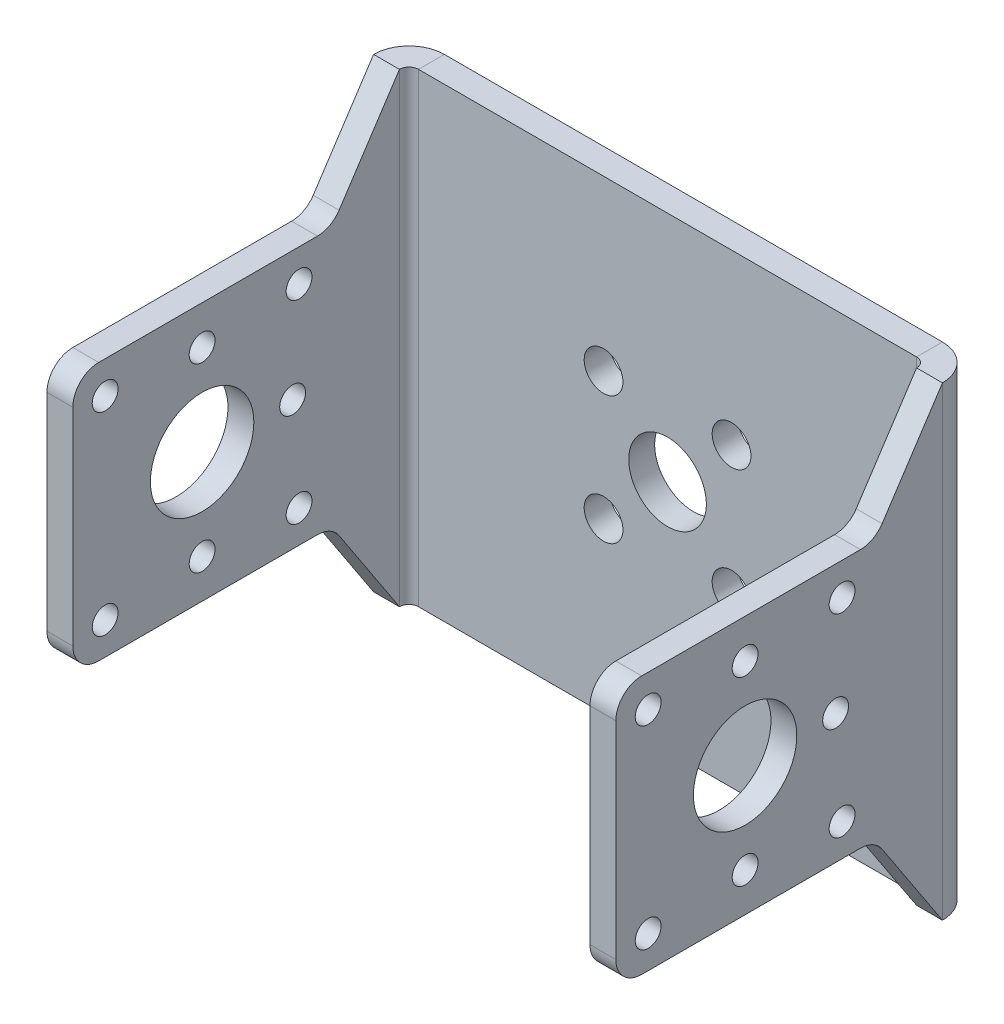
from build123d import *

# Parameters (mm, degrees)
SKETCH_1_W                       = 44
SKETCH_1_H                       = 36
SM_BASE_FLANGE_1_DEPTH           = 2
SM_EDGE_FLANGE_3_STRIP_W         = 9.4732
SM_EDGE_FLANGE_3_STRIP_H         = 2
SM_EDGE_FLANGE_3_STRIP_CUT_DEPTH = 36
SM_EDGE_FLANGE_3_DEPTH           = 36
SM_EDGE_FLANGE_4_STRIP_W         = 9.4732
SM_EDGE_FLANGE_4_STRIP_H         = 2
SM_EDGE_FLANGE_4_STRIP_CUT_DEPTH = 36
SM_EDGE_FLANGE_4_DEPTH           = 36
CUT_EXTRUDE_2_DEPTH              = 50
SKETCH_20_R                      = 1
CUT_EXTRUDE_3_DEPTH              = 50
FILLET_2_R                       = 2
FILLET_3_R                       = 2
FILLET_4_R                       = 2
FILLET_5_R                       = 2
FILLET_8_R                       = 2
FILLET_9_R                       = 2
FILLET_10_R                      = 2
FILLET_11_R                      = 2
SKETCH_21_R                      = 3
SKETCH_21_R_2                    = 1.5
CUT_EXTRUDE_4_DEPTH              = 2
SKETCH_22_R                      = 4
CUT_EXTRUDE_5_DEPTH              = 50


# Sheet-metal steps are written as plain solids
with BuildPart() as part:
    # Sketch 1 → 基体-法兰1 (new body)
    with BuildSketch(Plane.XY):
        with Locations((1.829071755, 6.237870574)):
            Rectangle(SKETCH_1_W, SKETCH_1_H)
    extrude(amount=-SM_BASE_FLANGE_1_DEPTH)

    # 边线-法兰3 strip (across the edge) → 边线-法兰3 strip cut (cut)
    with BuildSketch(Plane(origin=(-20.170928245, 24.237870574, 0), x_dir=(1, 0, 0), z_dir=(0, -1, 0))):
        with Locations((-2, -1)):
            Rectangle(SM_EDGE_FLANGE_3_STRIP_W, SM_EDGE_FLANGE_3_STRIP_H)
    extrude(amount=SM_EDGE_FLANGE_3_STRIP_CUT_DEPTH, mode=Mode.SUBTRACT)

    # 边线-法兰3 section (across the edge) → 边线-法兰3 (add)
    with BuildSketch(Plane(origin=(-20.170928245, 24.237870574, 0), x_dir=(1, 0, 0), z_dir=(0, -1, 0))):
        with BuildLine():
            Line((0, 0.7366), (0, 26))
            Line((0, 26), (2, 26))
            Line((2, 26), (2, 0.7366))
            ThreePointArc((2, 0.7366), (2.215745145, 0.215745145), (2.7366, 0))
            Line((2.7366, 0), (2.7366, -2))
            ThreePointArc((2.7366, -2), (0.801531583, -1.198468417), (0, 0.7366))
        make_face()
    extrude(amount=SM_EDGE_FLANGE_3_DEPTH)

    # 边线-法兰4 strip (across the edge) → 边线-法兰4 strip cut (cut)
    with BuildSketch(Plane(origin=(23.829071755, -11.762129426, 0), x_dir=(-1, 0, 0), z_dir=(0, 1, 0))):
        with Locations((-2, -1)):
            Rectangle(SM_EDGE_FLANGE_4_STRIP_W, SM_EDGE_FLANGE_4_STRIP_H)
    extrude(amount=SM_EDGE_FLANGE_4_STRIP_CUT_DEPTH, mode=Mode.SUBTRACT)

    # 边线-法兰4 section (across the edge) → 边线-法兰4 (add)
    with BuildSketch(Plane(origin=(23.829071755, -11.762129426, 0), x_dir=(-1, 0, 0), z_dir=(0, 1, 0))):
        with BuildLine():
            Line((0, 0.7366), (0, 26))
            Line((0, 26), (2, 26))
            Line((2, 26), (2, 0.7366))
            ThreePointArc((2, 0.7366), (2.215745145, 0.215745145), (2.7366, 0))
            Line((2.7366, 0), (2.7366, -2))
            ThreePointArc((2.7366, -2), (0.801531583, -1.198468417), (0, 0.7366))
        make_face()
    extrude(amount=SM_EDGE_FLANGE_4_DEPTH)

    # 草图19 → 切除-拉伸2 (cut)
    with BuildSketch(Plane.ZY.offset(20.170928245)):
        Polygon((6, 16.237870574), (26, 16.237870574), (26, 24.237870574), (0.7366, 24.237870574), align=None)
        Polygon((26, -11.762129426), (26, -3.762129426), (6, -3.762129426), (0.7366, -11.762129426), align=None)
    extrude(amount=-CUT_EXTRUDE_2_DEPTH, mode=Mode.SUBTRACT)

    # 草图20 → 切除-拉伸3 (cut)
    with BuildSketch(Plane.ZY.offset(20.170928245)):
        with Locations((23.5, 13.737870574)):
            Circle(SKETCH_20_R)
        with Locations((8.5, 13.737870574)):
            Circle(SKETCH_20_R)
        with Locations((8.5, -1.262129426)):
            Circle(SKETCH_20_R)
        with Locations((23.5, -1.262129426)):
            Circle(SKETCH_20_R)
        with Locations((9, 6.237870574)):
            Circle(SKETCH_20_R)
        with Locations((16, -0.762129426)):
            Circle(SKETCH_20_R)
        with Locations((16, 13.237870574)):
            Circle(SKETCH_20_R)
    extrude(amount=-CUT_EXTRUDE_3_DEPTH, mode=Mode.SUBTRACT)

    # 圆角2
    fillet_2_edges = [part.edges().sort_by_distance(p)[0] for p in [
        (-19.170928245, -3.762129426, 26),
    ]]
    fillet(fillet_2_edges, radius=FILLET_2_R)

    # 圆角3
    fillet_3_edges = [part.edges().sort_by_distance(p)[0] for p in [
        (-19.170928245, 16.237870574, 26),
    ]]
    fillet(fillet_3_edges, radius=FILLET_3_R)

    # 圆角4
    fillet_4_edges = [part.edges().sort_by_distance(p)[0] for p in [
        (22.829071755, 16.237870574, 26),
    ]]
    fillet(fillet_4_edges, radius=FILLET_4_R)

    # 圆角5
    fillet_5_edges = [part.edges().sort_by_distance(p)[0] for p in [
        (22.829071755, -3.762129426, 26),
    ]]
    fillet(fillet_5_edges, radius=FILLET_5_R)

    # 圆角8
    fillet_8_edges = [part.edges().sort_by_distance(p)[0] for p in [
        (22.829071755, -3.762129426, 6),
    ]]
    fillet(fillet_8_edges, radius=FILLET_8_R)

    # 圆角9
    fillet_9_edges = [part.edges().sort_by_distance(p)[0] for p in [
        (22.829071755, 16.237870574, 6),
    ]]
    fillet(fillet_9_edges, radius=FILLET_9_R)

    # 圆角10
    fillet_10_edges = [part.edges().sort_by_distance(p)[0] for p in [
        (-19.170928245, 16.237870574, 6),
    ]]
    fillet(fillet_10_edges, radius=FILLET_10_R)

    # 圆角11
    fillet_11_edges = [part.edges().sort_by_distance(p)[0] for p in [
        (-19.170928245, -3.762129426, 6),
    ]]
    fillet(fillet_11_edges, radius=FILLET_11_R)

    # 草图21 → 切除-拉伸4 (cut)
    with BuildSketch(Plane(origin=(0, 0, -2), x_dir=(-1, 0, 0), z_dir=(0, 0, -1))):
        with Locations((-1.829071755, 6.237870574)):
            Circle(SKETCH_21_R)
        with Locations((3.120675713, 11.187618042)):
            Circle(SKETCH_21_R_2)
        with Locations(Location((-6.778819223, 11.187618042, 0), (0, 0, 180))):
            Circle(SKETCH_21_R_2)
        with Locations((-6.778819223, 1.288123106)):
            Circle(SKETCH_21_R_2)
        with Locations(Location((3.120675713, 1.288123106, 0), (0, 0, 180))):
            Circle(SKETCH_21_R_2)
    extrude(amount=-CUT_EXTRUDE_4_DEPTH, mode=Mode.SUBTRACT)

    # 草图22 → 切除-拉伸5 (cut)
    with BuildSketch(Plane.ZY.offset(20.170928245)):
        with Locations((16, 6.237870574)):
            Circle(SKETCH_22_R)
    extrude(amount=-CUT_EXTRUDE_5_DEPTH, mode=Mode.SUBTRACT)


solid = part.part
